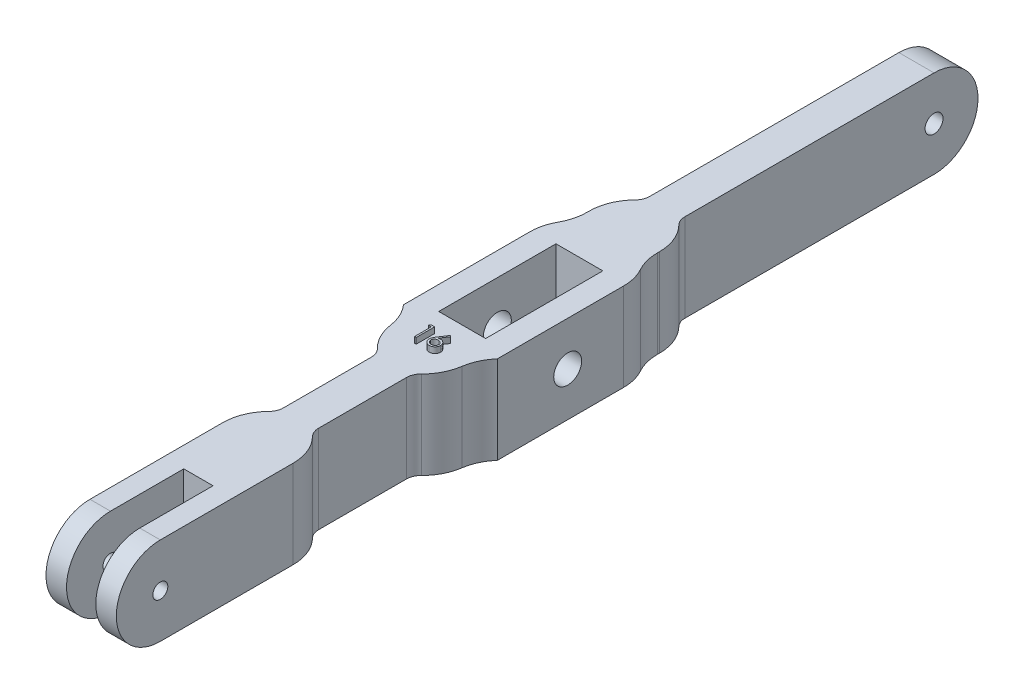
from build123d import *

# Parameters (mm, degrees)
SKETCH1_R           = 1.28
SKETCH1_R_2         = 2.38125
SKETCH1_R_3         = 1.53
BASE_DEPTH          = 6
ALL_CUTS_DEPTH      = 76.612498967
ALL_CUTS_DEPTH_BACK = 76.612498967
SKETCH2_W           = 5
SKETCH2_H           = 40
SKETCH2_W_2         = 6
SKETCH2_H_2         = 20
SKETCH2_H_3         = 52.5
SKETCH2_W_3         = 8
SKETCH3_W           = 16
SKETCH3_H           = 24
SKETCH3_W_2         = 8
SKETCH3_H_2         = 20
BOSS_EXTRUDE1_DEPTH = 15
SKETCH4_R           = 2.38125
CUT_EXTRUDE1_DEPTH  = 78.053552806
FILLET1_R           = 2.5
FILLET2_R           = 8
FILLET3_R           = 8
BOSS_EXTRUDE2_DEPTH = 1


with BuildPart() as part:
    # Sketch1 → BASE (new, symmetric)
    with BuildSketch(Plane(origin=(0, 0, 0), x_dir=(0, 0, -1), z_dir=(1, 0, 0))):
        with BuildLine():
            Line((-67.5, 7.5), (67.5, 7.5))
            ThreePointArc((67.5, 7.5), (75, 0), (67.5, -7.5))
            Line((67.5, -7.5), (-67.5, -7.5))
            ThreePointArc((-67.5, -7.5), (-75, 0), (-67.5, 7.5))
        make_face()
        with Locations((-67.5, 0)):
            Circle(SKETCH1_R, mode=Mode.SUBTRACT)
        Circle(SKETCH1_R_2, mode=Mode.SUBTRACT)
        with Locations((67.5, 0)):
            Circle(SKETCH1_R_3, mode=Mode.SUBTRACT)
    extrude(amount=BASE_DEPTH, both=True)

    # Sketch2 → All_Cuts (cut, two sides: drawn at the far end of the back side and taken through both)
    with BuildSketch(Plane(origin=(0, 0, 0), x_dir=(1, 0, 0), z_dir=(0, 1, 0)).offset(-ALL_CUTS_DEPTH_BACK)):
        with Locations((0, -75)):
            Rectangle(SKETCH2_W, SKETCH2_H)
        with Locations((-6, -30)):
            Rectangle(SKETCH2_W_2, SKETCH2_H_2)
        with Locations((6, -30)):
            Rectangle(SKETCH2_W_2, SKETCH2_H_2)
        with Locations((6, 48.75)):
            Rectangle(SKETCH2_W_2, SKETCH2_H_3)
        with Locations((-6, 48.75)):
            Rectangle(SKETCH2_W_2, SKETCH2_H_3)
        Rectangle(SKETCH2_W_3, SKETCH2_H_2)
    extrude(amount=ALL_CUTS_DEPTH + ALL_CUTS_DEPTH_BACK, mode=Mode.SUBTRACT)

    # Sketch3 → Boss-Extrude1 (add, through all)
    with BuildSketch(Plane.XZ.offset(7.5)):
        Rectangle(SKETCH3_W, SKETCH3_H)
        Rectangle(SKETCH3_W_2, SKETCH3_H_2, mode=Mode.SUBTRACT)
    extrude(amount=-BOSS_EXTRUDE1_DEPTH)

    # Sketch4 → Cut-Extrude1 (cut, through all)
    with BuildSketch(Plane.ZY.offset(8)):
        Circle(SKETCH4_R)
    extrude(amount=-CUT_EXTRUDE1_DEPTH, mode=Mode.SUBTRACT)

    # Fillet1
    fillet1_edges = [part.edges().sort_by_distance(p)[0] for p in [
        (3, 0, 20),
        (3, 0, 40),
        (-3, 0, 40),
        (-3, 0, 20),
        (3, 0, -22.5),
        (-3, 0, -22.5),
    ]]
    fillet(fillet1_edges, radius=FILLET1_R)

    # Fillet2
    # the kernel refuses this fillet: 8 mm, written as the material it adds along each edge
    with BuildSketch(Plane(origin=(-6, -7.5, -12), x_dir=(0, 0, -1), z_dir=(0, 1, 0))) as fillet2_piece_1:
        with BuildLine():
            CenterArc((5.291502622, 8), FILLET2_R, 228.590377891, 41.409622109)
            Line((0, 2), (-0.105830052, 1.88))
            ThreePointArc((-0.105830052, 1.88), (-0.16, 1), (-0.16, 0))
            Line((-0.16, 0), (0, -0.16))
            Line((0, -0.16), (5.291502622, -0.16))
            Line((5.291502622, -0.16), (5.291502622, 0))
        make_face()
    extrude(amount=15)
    with BuildSketch(Plane(origin=(6, -7.5, -12), x_dir=(1, 0, 0), z_dir=(0, 1, 0))) as fillet2_piece_2:
        with BuildLine():
            CenterArc((8, 5.291502622), FILLET2_R, 180, 41.409622109)
            Line((0, 5.291502622), (-0.16, 5.291502622))
            Line((-0.16, 5.291502622), (-0.16, 0))
            Line((-0.16, 0), (0, -0.16))
            ThreePointArc((0, -0.16), (1, -0.16), (1.88, -0.105830052))
            Line((1.88, -0.105830052), (2, 0))
        make_face()
    extrude(amount=15)
    with BuildSketch(Plane(origin=(6, 7.5, 12), x_dir=(0, 0, 1), z_dir=(0, -1, 0))) as fillet2_piece_3:
        with BuildLine():
            CenterArc((5.291502622, -8), FILLET2_R, 90, 41.409622109)
            Line((0, -2), (-0.105830052, -1.88))
            ThreePointArc((-0.105830052, -1.88), (-0.16, -1), (-0.16, 0))
            Line((-0.16, 0), (0, 0.16))
            Line((0, 0.16), (5.291502622, 0.16))
            Line((5.291502622, 0.16), (5.291502622, 0))
        make_face()
    extrude(amount=15)
    with BuildSketch(Plane(origin=(-6, 7.5, 12), x_dir=(-1, 0, 0), z_dir=(0, -1, 0))) as fillet2_piece_4:
        with BuildLine():
            CenterArc((8, -5.291502622), FILLET2_R, 138.590377891, 41.409622109)
            Line((0, -5.291502622), (-0.16, -5.291502622))
            Line((-0.16, -5.291502622), (-0.16, 0))
            Line((-0.16, 0), (0, 0.16))
            ThreePointArc((0, 0.16), (1, 0.16), (1.88, 0.105830052))
            Line((1.88, 0.105830052), (2, 0))
        make_face()
    extrude(amount=15)

    # Fillet3
    fillet3_edges = [part.edges().sort_by_distance(p)[0] for p in [
        (8, 0, -12),
        (-8, 0, -12),
        (-6, 0, 20),
        (6, 0, 20),
        (-6, 0, -22.5),
        (6, 0, -22.5),
        (6, 0, 40),
        (-6, 0, 40),
    ]]
    fillet(fillet3_edges, radius=FILLET3_R)

    # Sketch5 → Boss-Extrude2 (add)
    # profile 1 of 2: a face of its own
    with BuildSketch(Plane(origin=(0, 7.5, 0), x_dir=(1, 0, 0), z_dir=(0, 1, 0))):
        Polygon((-1.663472098, -13.613490945), (-1.082899181, -13.613490945), (-1.082899181, -16.753490945), (-1.364694053, -16.753490945), (-1.364694053, -13.935542228), (-1.847770976, -13.935542228), align=None)
    # profile 2 of 2: a face of its own
    with BuildSketch(Plane(origin=(0, 7.5, 0), x_dir=(1, 0, 0), z_dir=(0, 1, 0))):
        with BuildLine():
            Line((1.533767485, -13.532978125), (1.750774697, -13.703438862))
            Line((1.750774697, -13.703438862), (0.921115242, -14.972144792))
            add(Edge.make_bspline(
                [(0.921115242, -14.972144792), (0.976352576, -14.963340357), (1.084099242, -14.946166311), (1.193161219, -14.943333183), (1.246311556, -14.941952484)],
                knots=[0, 0, 0, 0, 1.025318673, 2, 2, 2, 2], degree=3))
            add(Edge.make_bspline(
                [(1.246311556, -14.941952484), (1.278225167, -14.942810253), (1.341046161, -14.944498745), (1.433278549, -14.957492828), (1.521906337, -14.977970214), (1.606562183, -15.007820181), (1.687549944, -15.045950865), (1.76533438, -15.091650308), (1.838453326, -15.147278262), (1.907848384, -15.209418822), (1.970852123, -15.278244917), (2.026632927, -15.351273544), (2.07348782, -15.42842862), (2.111503281, -15.509671066), (2.141023658, -15.594875647), (2.162544002, -15.68393335), (2.175265123, -15.776905584), (2.176992563, -15.840134576), (2.17787005, -15.872252965)],
                knots=[0, 0, 0, 0, 1.04369286, 2.054478336, 3.041073146, 4.015093852, 4.984733326, 5.965804835, 6.960378782, 7.985147595, 9.009457201, 10.008161701, 10.986880575, 11.956520048, 12.937015923, 13.931873656, 14.949455224, 16, 16, 16, 16], degree=3))
            add(Edge.make_bspline(
                [(2.17787005, -15.872252965), (2.176593321, -15.916194756), (2.174081022, -16.002661803), (2.149047331, -16.128599762), (2.110147535, -16.248576933), (2.054544838, -16.360677779), (1.985480643, -16.464748655), (1.901259031, -16.556961901), (1.804866873, -16.639203021), (1.69587586, -16.707974959), (1.578580744, -16.764138839), (1.45535638, -16.804479085), (1.327399455, -16.829315112), (1.240551892, -16.832428738), (1.19662005, -16.834003766)],
                knots=[0, 0, 0, 0, 1.031375318, 2.029502543, 3.004789286, 3.987476834, 4.960371455, 5.9300674, 6.912260825, 7.929083631, 8.949397511, 9.960523116, 10.96833055, 12, 12, 12, 12], degree=3))
            add(Edge.make_bspline(
                [(1.19662005, -16.834003766), (1.154367581, -16.832632747), (1.070672839, -16.829916999), (0.947555417, -16.8057247), (0.829255453, -16.766513185), (0.71660178, -16.712492375), (0.612245573, -16.644257589), (0.518883831, -16.562113144), (0.436982067, -16.467814938), (0.368821979, -16.361377598), (0.314761288, -16.247000893), (0.274219469, -16.127737273), (0.250538268, -16.00402129), (0.247229106, -15.920155353), (0.245562357, -15.877914022)],
                knots=[0, 0, 0, 0, 1.012016664, 2.004627821, 2.994792927, 3.992885782, 4.990978636, 5.973936114, 6.964471063, 7.975201453, 8.993600317, 9.990122807, 10.98767138, 12, 12, 12, 12], degree=3))
            add(Edge.make_bspline(
                [(0.245562357, -15.877914022), (0.246622282, -15.845576882), (0.248786446, -15.77955062), (0.263897374, -15.679551463), (0.288178361, -15.57723135), (0.315370982, -15.490429016), (0.344102529, -15.419320108), (0.368013665, -15.361989548), (0.397775479, -15.302992471), (0.429510455, -15.240305837), (0.466075189, -15.175545192), (0.505832657, -15.107628186), (0.549882058, -15.037634959), (0.580761861, -14.990136453), (0.596547934, -14.965854728)],
                knots=[0, 0, 0, 0, 1.173818275, 2.396712641, 3.66331629, 4.989737886, 5.693666774, 6.447286557, 7.243889047, 8.091586357, 8.998013824, 9.943181721, 10.948533338, 12, 12, 12, 12], degree=3))
            Line((0.596547934, -14.965854728), (1.533767485, -13.532978125))
        make_face()
        with BuildLine():
            add(Edge.make_bspline(
                [(1.187184953, -15.264003766), (1.163265111, -15.264701782), (1.11654271, -15.266065211), (1.047994344, -15.273982723), (0.983119027, -15.288892399), (0.921057255, -15.307881622), (0.862969316, -15.333991224), (0.808433043, -15.365706838), (0.757237539, -15.403046981), (0.709919038, -15.445482655), (0.667017969, -15.491943919), (0.630072611, -15.541708005), (0.598203944, -15.593575604), (0.572292826, -15.64798009), (0.552116016, -15.704900664), (0.537521071, -15.764075533), (0.529398562, -15.82590151), (0.528047257, -15.867827242), (0.527357229, -15.889236138)],
                knots=[0, 0, 0, 0, 1.129588631, 2.206414736, 3.251139165, 4.268635594, 5.265702196, 6.250456724, 7.242448911, 8.251968645, 9.246821453, 10.222880186, 11.173611482, 12.116736599, 13.062300278, 14.020270554, 14.989073742, 16, 16, 16, 16], degree=3))
            add(Edge.make_bspline(
                [(0.527357229, -15.889236138), (0.527919165, -15.910453548), (0.529021037, -15.952057732), (0.539026261, -16.013367738), (0.554309164, -16.072368256), (0.577043119, -16.128755119), (0.604160956, -16.183387816), (0.639961732, -16.234287472), (0.679630506, -16.284545478), (0.727048035, -16.330301084), (0.777936995, -16.372876455), (0.83230493, -16.410090168), (0.888968437, -16.441926335), (0.948692513, -16.466876863), (1.010629806, -16.487353509), (1.07529636, -16.50176295), (1.142737151, -16.509909479), (1.188421404, -16.511262544), (1.211716203, -16.511952484)],
                knots=[0, 0, 0, 0, 0.989467248, 1.94019797, 2.891935182, 3.827694429, 4.772920941, 5.730924762, 6.725747692, 7.756678648, 8.79901574, 9.819492441, 10.826891316, 11.826466727, 12.835195252, 13.867842842, 14.912794438, 16, 16, 16, 16], degree=3))
            add(Edge.make_bspline(
                [(1.211716203, -16.511952484), (1.235010965, -16.51126249), (1.280695143, -16.509909319), (1.348136476, -16.501763559), (1.412801025, -16.487351275), (1.474745607, -16.466884961), (1.534442776, -16.441896294), (1.591056726, -16.410288229), (1.644910502, -16.372647597), (1.695832868, -16.330373842), (1.74305303, -16.284285055), (1.783673217, -16.234736104), (1.818377604, -16.182976438), (1.84657856, -16.128970331), (1.869062119, -16.072334162), (1.884422521, -16.013376872), (1.894407083, -15.95205534), (1.895511794, -15.910452741), (1.896075178, -15.889236138)],
                knots=[0, 0, 0, 0, 1.087397944, 2.132534446, 3.165364764, 4.174271784, 5.174024072, 6.181601208, 7.194203697, 8.236725232, 9.267838612, 10.269026844, 11.221737037, 12.171628256, 13.107553087, 14.05945871, 15.010357665, 16, 16, 16, 16], degree=3))
            add(Edge.make_bspline(
                [(1.896075178, -15.889236138), (1.895581486, -15.867799312), (1.894612531, -15.825725795), (1.88365308, -15.764103189), (1.86845335, -15.704600004), (1.845501717, -15.64759021), (1.815683788, -15.593298778), (1.779364389, -15.541451456), (1.737348883, -15.491650744), (1.688815661, -15.445391539), (1.635982709, -15.403093875), (1.579807583, -15.365755187), (1.521037573, -15.334243065), (1.459732264, -15.307950408), (1.395189221, -15.288976308), (1.32845046, -15.27403597), (1.258662396, -15.266085474), (1.211314239, -15.264706507), (1.187184953, -15.264003766)],
                knots=[0, 0, 0, 0, 0.978206639, 1.919901502, 2.851605144, 3.780102724, 4.718870031, 5.675451981, 6.667674623, 7.690630536, 8.733308323, 9.756129687, 10.767539656, 11.776269907, 12.797430371, 13.836405707, 14.897401972, 16, 16, 16, 16], degree=3))
        make_face(mode=Mode.SUBTRACT)
    extrude(amount=BOSS_EXTRUDE2_DEPTH)


solid = part.part
